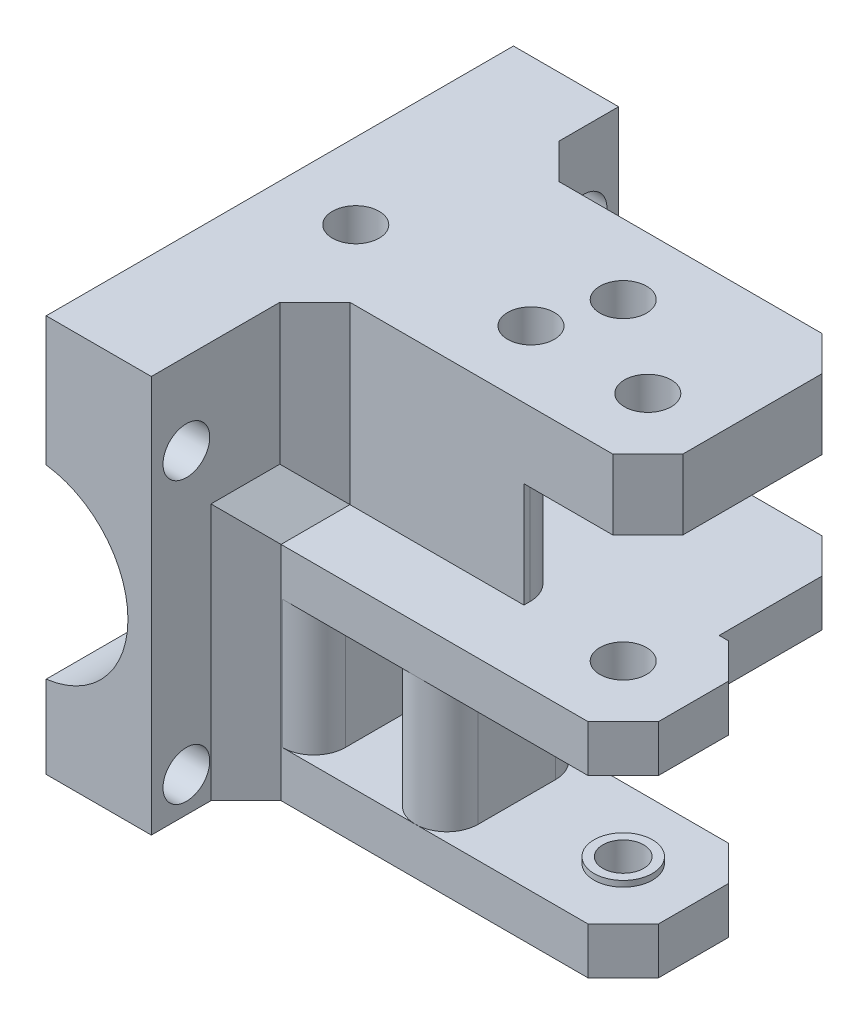
from build123d import *

# Parameters (mm, degrees)
BOSS_EXTRUDE1_DEPTH      = 20
BOSS_EXTRUDE1_DEPTH_BACK = 20
SKETCH2_R                = 1.75
CUT_EXTRUDE1_DEPTH       = 59.72818744
SKETCH3_R                = 2
CUT_EXTRUDE2_DEPTH       = 7
CUT_EXTRUDE3_REACH       = 60.728
CUT_EXTRUDE4_REACH       = 54.783
CUT_EXTRUDE5_REACH       = 58.648
BOSS_EXTRUDE3_DEPTH      = 9
SKETCH10_W               = 5.38
SKETCH10_H               = 12
SKETCH10_W_2             = 5.81
BOSS_EXTRUDE4_DEPTH      = 11
FILLET1_R                = 2.69
FILLET2_R                = 2.69
FILLET3_R                = 2.69
CHAMFER1_SIZE            = 3
CUT_EXTRUDE8_REACH       = 51.774
SKETCH14_R               = 2
SKETCH16_R               = 2
CUT_EXTRUDE9_DEPTH       = 10
BOSS_EXTRUDE5_START      = 0.5
SKETCH17_R               = 2.5
SKETCH17_R_2             = 1.75
BOSS_EXTRUDE5_DEPTH      = 0.5
BOSS_EXTRUDE6_START      = 0.5
SKETCH18_R               = 2.5
SKETCH18_R_2             = 1.75
BOSS_EXTRUDE6_DEPTH      = 0.5
SKETCH20_R               = 3
CUT_EXTRUDE10_DEPTH      = 2
SKETCH21_R               = 3
CUT_EXTRUDE11_DEPTH      = 2
SKETCH11_R               = 2
CUT_EXTRUDE6_DEPTH       = 10
SKETCH12_W               = 1
SKETCH12_H               = 32
CUT_EXTRUDE7_DEPTH       = 67.426230512
BOSS_EXTRUDE7_DEPTH      = 4
BOSS_EXTRUDE8_START      = 2
SKETCH23_R               = 2
BOSS_EXTRUDE8_DEPTH      = 2


# Some blends are built 0.0001 mm under size
with BuildPart() as part:
    # Sketch1 → Boss-Extrude1 (new, two sides: drawn at the far end of the back side and taken through both)
    with BuildSketch(Plane.XY.offset(-BOSS_EXTRUDE1_DEPTH_BACK)):
        with BuildLine():
            Line((0, 0), (45, 0))
            Line((45, 0), (45, -4))
            Line((45, -4), (10, -4))
            Line((10, -4), (10, -13))
            Line((10, -13), (45, -13))
            Line((45, -13), (45, -17))
            Line((45, -17), (10, -17))
            Line((10, -17), (10, -28))
            Line((10, -28), (45, -28))
            Line((45, -28), (45, -32))
            Line((45, -32), (0, -32))
            Line((0, -32), (0, -28))
            Line((0, -28), (0, -25))
            ThreePointArc((0, -25), (8, -17), (0, -9))
            Line((0, -9), (0, -4))
            Line((0, -4), (0, 0))
        make_face()
    extrude(amount=BOSS_EXTRUDE1_DEPTH + BOSS_EXTRUDE1_DEPTH_BACK)

    # Sketch2 → Cut-Extrude1 (cut, through all)
    with BuildSketch(Plane(origin=(0, 0, 0), x_dir=(1, 0, 0), z_dir=(0, 1, 0))):
        with Locations(Location((24.5, 5.895, 0), (0, 0, 270))):
            Circle(SKETCH2_R)
        with Locations(Location((36.29, -5.895, 0), (0, 0, 270))):
            Circle(SKETCH2_R)
    extrude(amount=-CUT_EXTRUDE1_DEPTH, mode=Mode.SUBTRACT)

    # Sketch3 → Cut-Extrude2 (cut)
    with BuildSketch(Plane(origin=(0, 0, 0), x_dir=(1, 0, 0), z_dir=(0, 1, 0))):
        with Locations(Location((7.5, 0, 0), (0, 0, 270))):
            Circle(SKETCH3_R)
        with Locations(Location((22.5, 0, 0), (0, 0, 270))):
            Circle(SKETCH3_R)
        with Locations(Location((32.5, 0, 0), (0, 0, 270))):
            Circle(SKETCH3_R)
    extrude(amount=-CUT_EXTRUDE2_DEPTH, mode=Mode.SUBTRACT)

    # Sketch5 → Cut-Extrude3 (cut, up to next)
    with BuildSketch(Plane(origin=(0, 0, 0), x_dir=(1, 0, 0), z_dir=(0, 1, 0)), mode=Mode.PRIVATE) as cut_extrude3_sk1:
        Polygon((10, 20), (10, 11.895), (35.5, 11.895), (38.5, 8.895), (38.5, -3), (35.5, -6), (10, -6), (10, -20), (45, -20), (45, 20), align=None)
    cut_extrude3_tool1 = extrude(cut_extrude3_sk1.sketch, amount=-CUT_EXTRUDE3_REACH, mode=Mode.PRIVATE) & part.part
    add(cut_extrude3_tool1.solids().sort_by_distance((10.531507, 0, -15.9475))[0], mode=Mode.SUBTRACT)

    # Sketch6 → Cut-Extrude4 (cut, up to next)
    with BuildSketch(Plane(origin=(0, -13, 0), x_dir=(1, 0, 0), z_dir=(0, 1, 0)), mode=Mode.PRIVATE) as cut_extrude4_sk1:
        Polygon((45, 20), (10, 20), (10, 11.895), (35.5, 11.895), (38.5, 8.895), (38.5, 0.105), (39.29, 0.105), (42.29, -2.895), (42.29, -8.895), (39.29, -11.895), (10, -11.895), (10, -20), (45, -20), align=None)
    cut_extrude4_tool1 = extrude(cut_extrude4_sk1.sketch, amount=-CUT_EXTRUDE4_REACH, mode=Mode.PRIVATE) & part.part
    add(cut_extrude4_tool1.solids().sort_by_distance((27.5, -13, -19.468493))[0], mode=Mode.SUBTRACT)

    # Sketch7 → Cut-Extrude5 (cut, up to next)
    with BuildSketch(Plane(origin=(0, -28, 0), x_dir=(1, 0, 0), z_dir=(0, 1, 0)), mode=Mode.PRIVATE) as cut_extrude5_sk1:
        Polygon((10, -11.895), (39.29, -11.895), (42.29, -8.895), (42.29, -2.895), (39.29, 0.105), (10, 0.105), (10, 20), (45, 20), (45, -20), (10, -20), align=None)
    cut_extrude5_tool1 = extrude(cut_extrude5_sk1.sketch, amount=-CUT_EXTRUDE5_REACH, mode=Mode.PRIVATE) & part.part
    add(cut_extrude5_tool1.solids().sort_by_distance((28.13547, -28, -2.184137))[0], mode=Mode.SUBTRACT)

    # Sketch9 → Boss-Extrude3 (add)
    with BuildSketch(Plane(origin=(0, -13, 0), x_dir=(1, 0, 0), z_dir=(0, 1, 0))):
        with BuildLine():
            ThreePointArc((24.5, -2.795), (18.355242071, -0.249757929), (15.81, 5.895))
            Line((15.81, 5.895), (15.81, 11.895))
            Line((15.81, 11.895), (10, 11.895))
            Line((10, 11.895), (10, -6))
            Line((10, -6), (27.895, -6))
            Line((27.895, -6), (27.895, -2.795))
            Line((27.895, -2.795), (24.5, -2.795))
        make_face()
    extrude(amount=BOSS_EXTRUDE3_DEPTH)

    # Sketch10 → Boss-Extrude4 (add)
    with BuildSketch(Plane(origin=(0, -28, 0), x_dir=(1, 0, 0), z_dir=(0, 1, 0))):
        with Locations((24.5, -5.895)):
            Rectangle(SKETCH10_W, SKETCH10_H)
        with Locations((12.905, -5.895)):
            Rectangle(SKETCH10_W_2, SKETCH10_H)
    extrude(amount=BOSS_EXTRUDE4_DEPTH)

    # Fillet1
    # the kernel refuses this fillet: 2.69 mm, written as the material it adds along each edge
    # the kernel refuses this fillet: 2.69 mm, written as the material it takes off along each edge
    with BuildSketch(Plane(origin=(21.81, -28, -0.105), x_dir=(0, 0, 1), z_dir=(0, 1, 0))) as fillet1_2_piece_1:
        with BuildLine():
            CenterArc((FILLET1_R, FILLET1_R), FILLET1_R, 180, 90)
            Line((0, FILLET1_R), (0, 0))
            Line((0, 0), (FILLET1_R, 0))
        make_face()
    extrude(amount=11, mode=Mode.SUBTRACT)
    with BuildSketch(Plane(origin=(27.19, -28, -0.105), x_dir=(0, 0, 1), z_dir=(0, 1, 0))) as fillet1_2_piece_2:
        with BuildLine():
            CenterArc((FILLET1_R, -FILLET1_R), FILLET1_R, 90, 90)
            Line((0, -FILLET1_R), (0, 0))
            Line((0, 0), (FILLET1_R, 0))
        make_face()
    extrude(amount=11, mode=Mode.SUBTRACT)

    # Fillet2
    fillet2_edges = [part.edges().sort_by_distance(p)[0] for p in [
        (27.19, -22.5, 11.895),
        (21.81, -22.5, 11.895),
    ]]
    fillet(fillet2_edges, radius=FILLET2_R - 0.0001)  # a hair under: the kernel refuses the full size

    # Fillet3
    fillet3_edges = [part.edges().sort_by_distance(p)[0] for p in [
        (15.81, -8.5, -11.895),
        (27.895, -8.5, 2.795),
        (15.81, -22.5, -0.105),
        (15.81, -22.5, 11.895),
    ]]
    fillet(fillet3_edges, radius=FILLET3_R)

    # Chamfer1
    chamfer1_edges = [part.edges().sort_by_distance(p)[0] for p in [
        (10, -8.5, -11.895),
        (10, -6.5, 6),
        (10, -17, -6),
        (10, -22.5, 11.895),
        (10, -24.5, -0.105),
        (10, -13, 8.9475),
    ]]
    chamfer(chamfer1_edges, length=CHAMFER1_SIZE)

    # Sketch14 → Cut-Extrude8 (cut, up to next)
    with BuildSketch(Plane.XZ.offset(17), mode=Mode.PRIVATE) as cut_extrude8_sk1:
        with Locations(Location((36.29, 5.895, 0), (0, 0, 270))):
            Circle(SKETCH14_R)
    cut_extrude8_tool1 = extrude(cut_extrude8_sk1.sketch, amount=-CUT_EXTRUDE8_REACH, mode=Mode.PRIVATE) & part.part
    add(cut_extrude8_tool1.solids().sort_by_distance((36.29, -17, 5.895))[0], mode=Mode.SUBTRACT)

    # Sketch16 → Cut-Extrude9 (cut)
    with BuildSketch(Plane.XZ.offset(4)):
        with Locations((24.5, -5.895)):
            Circle(SKETCH16_R)
    extrude(amount=-CUT_EXTRUDE9_DEPTH, mode=Mode.SUBTRACT)

    # Sketch17 → Boss-Extrude5 (add)
    with BuildSketch(Plane(origin=(0, -13, 0), x_dir=(1, 0, 0), z_dir=(0, 1, 0)).offset(BOSS_EXTRUDE5_START)):
        with Locations(Location((24.5, 5.895, 0), (0, 0, 270))):
            Circle(SKETCH17_R)
        with Locations(Location((24.5, 5.895, 0), (0, 0, 270))):
            Circle(SKETCH17_R_2, mode=Mode.SUBTRACT)
    extrude(amount=-BOSS_EXTRUDE5_DEPTH)

    # Sketch18 → Boss-Extrude6 (add)
    with BuildSketch(Plane(origin=(0, -28, 0), x_dir=(1, 0, 0), z_dir=(0, 1, 0)).offset(BOSS_EXTRUDE6_START)):
        with Locations(Location((36.29, -5.895, 0), (0, 0, 270))):
            Circle(SKETCH18_R)
        with Locations(Location((36.29, -5.895, 0), (0, 0, 270))):
            Circle(SKETCH18_R_2, mode=Mode.SUBTRACT)
    extrude(amount=-BOSS_EXTRUDE6_DEPTH)

    # Sketch20 → Cut-Extrude10 (cut)
    with BuildSketch(Plane.XZ.offset(32)):
        with Locations(Location((36.29, 5.895, 0), (0, 0, 270))):
            Circle(SKETCH20_R)
    extrude(amount=-CUT_EXTRUDE10_DEPTH, mode=Mode.SUBTRACT)

    # Sketch21 → Cut-Extrude11 (cut)
    with BuildSketch(Plane.XZ.offset(17)):
        with Locations(Location((24.5, -5.895, 0), (0, 0, 270))):
            Circle(SKETCH21_R)
    extrude(amount=-CUT_EXTRUDE11_DEPTH, mode=Mode.SUBTRACT)

    # Sketch11 → Cut-Extrude6 (cut)
    with BuildSketch(Plane.ZY):
        with Locations(Location((17, -5, 0), (0, 0, 270))):
            Circle(SKETCH11_R)
        with Locations(Location((17, -29, 0), (0, 0, 270))):
            Circle(SKETCH11_R)
        with Locations(Location((-17, -29, 0), (0, 0, 270))):
            Circle(SKETCH11_R)
        with Locations(Location((-17, -5, 0), (0, 0, 270))):
            Circle(SKETCH11_R)
    extrude(amount=-CUT_EXTRUDE6_DEPTH, mode=Mode.SUBTRACT)

    # Sketch12 → Cut-Extrude7 (cut, through all)
    with BuildSketch(Plane.XY.offset(20)):
        with Locations((0.5, -16)):
            Rectangle(SKETCH12_W, SKETCH12_H)
    extrude(amount=-CUT_EXTRUDE7_DEPTH, mode=Mode.SUBTRACT)

    # Sketch22 → Boss-Extrude7 (add)
    with BuildSketch(Plane(origin=(0, 0, 0), x_dir=(1, 0, 0), z_dir=(0, 1, 0))):
        with BuildLine():
            Line((37.136593667, -4.363406333), (35.5, -6))
            Line((35.5, -6), (34.54315284, -6))
            ThreePointArc((34.54315284, -6), (35.356070776, -4.415041823), (37.136593667, -4.363406333))
        make_face()
    extrude(amount=-BOSS_EXTRUDE7_DEPTH)

    # Sketch23 → Boss-Extrude8 (add)
    with BuildSketch(Plane(origin=(0, 0, 0), x_dir=(1, 0, 0), z_dir=(0, 1, 0)).offset(BOSS_EXTRUDE8_START)):
        Polygon((35.5, 11.895), (13, 11.895), (10, 14.895), (10, 20), (1, 20), (1, -20), (10, -20), (10, -9), (13, -6), (35.5, -6), (38.5, -3), (38.5, 8.895), align=None)
        with Locations((24.5, 5.895)):
            Circle(SKETCH23_R, mode=Mode.SUBTRACT)
        with Locations(Location((32.5, 0, 0), (0, 0, 270))):
            Circle(SKETCH23_R, mode=Mode.SUBTRACT)
        with Locations(Location((22.5, 0, 0), (0, 0, 270))):
            Circle(SKETCH23_R, mode=Mode.SUBTRACT)
        with Locations(Location((7.5, 0, 0), (0, 0, 270))):
            Circle(SKETCH23_R, mode=Mode.SUBTRACT)
    extrude(amount=-BOSS_EXTRUDE8_DEPTH)


solid = part.part
